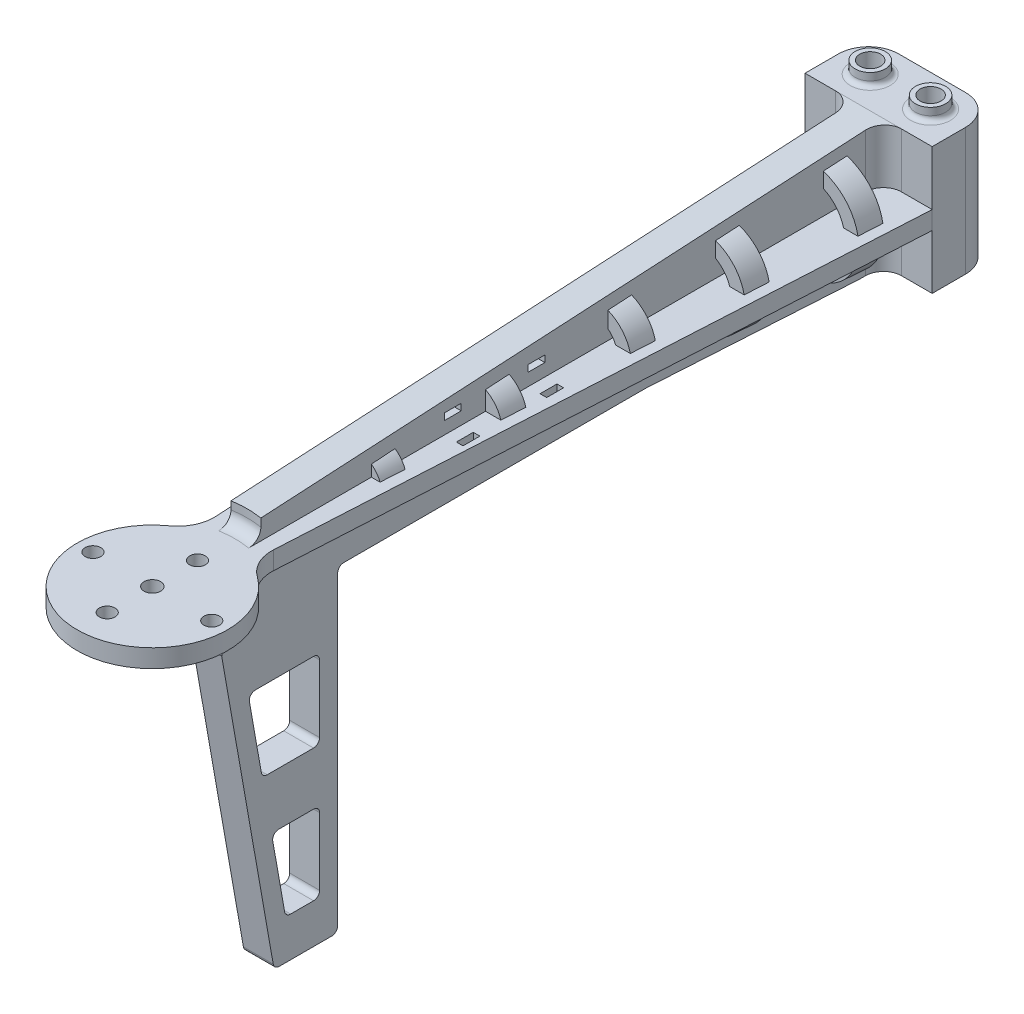
from build123d import *

# Parameters (mm, degrees)
SKETCH1_W                     = 26.7589
SKETCH1_H                     = 26.7589
BOSS_EXTRUDE1_DEPTH           = 13.37945
SKETCH2_W                     = 3.556
SKETCH2_H                     = 1.397
BOSS_EXTRUDE2_DEPTH           = 3.140604167
SKETCH3_W                     = 1.397
SKETCH3_H                     = 3.556
BOSS_EXTRUDE3_DEPTH           = 1.905
FILLET1_R                     = 6.35
SKETCH5_R                     = 15.8250001
BOSS_EXTRUDE4_DEPTH           = 1.905
SKETCH6_R                     = 13.97
CUT_EXTRUDE2_DEPTH            = 198.322668483
SKETCH25_R                    = 1.749997008
CUT_EXTRUDE8_DEPTH            = 198.322668483
SKETCH26_R                    = 1.6499967
CUT_EXTRUDE9_DEPTH            = 198.322668483
FILLET6_R                     = 7.62
BOSS_EXTRUDE6_REACH           = 197.819
SKETCH22_R                    = 6.35
SKETCH9_R                     = 3.175
BOSS_EXTRUDE5_DEPTH           = 2.54
CBORE_FOR_M3_SHCS1_AT_2_COUNT = 2
CBORE_FOR_M3_SHCS1_AT_2_PITCH = 18.9999874
FILLET9_R                     = 1
SKETCH16_R                    = 2.200000045
CUT_EXTRUDE3_DEPTH            = 204.37109041
SKETCH23_W                    = 31.6500002
SKETCH23_H                    = 25.4
CUT_EXTRUDE6_DEPTH            = 196.819485483
FILLET13_R                    = 3.81
FILLET14_R                    = 3.81
FILLET15_R                    = 3.81
FILLET16_R                    = 3.81
FILLET20_START                = 121.147482131
FILLET20_DEPTH                = 29.852517869
SKETCH28_W                    = 28.2999942
SKETCH28_H                    = 101.6
CUT_EXTRUDE11_DEPTH           = 198.322668623
SKETCH29_R                    = 19.939
CUT_EXTRUDE12_DEPTH           = 198.322668623
FILLET21_R                    = 2.54


with BuildPart() as part:
    # Sketch1 → Boss-Extrude1 (new body)
    with BuildSketch(Plane.XY):
        Rectangle(SKETCH1_W, SKETCH1_H)
    extrude(amount=BOSS_EXTRUDE1_DEPTH)

    # Sketch2 → Boss-Extrude2 (add, symmetric)
    with BuildSketch(Plane(origin=(0, 0, 0), x_dir=(0, 0, -1), z_dir=(1, 0, 0))):
        with BuildLine():
            Line((-13.37945, 13.37945), (-179.36845, 4.149725))
            Line((-179.36845, 4.149725), (-179.36845, -4.149725))
            Line((-179.36845, -4.149725), (-154.89168596, -7.372152119))
            ThreePointArc((-154.89168596, -7.372152119), (-154.179232644, -7.713884861), (-153.806748378, -8.410753907))
            Line((-153.806748378, -8.410753907), (-141.799904362, -76.504950086))
            ThreePointArc((-141.799904362, -76.504950086), (-141.36553878, -77.257293343), (-140.549198516, -77.5544169))
            Line((-140.549198516, -77.5544169), (-129.505405047, -77.5544169))
            ThreePointArc((-129.505405047, -77.5544169), (-128.607379435, -77.182442512), (-128.235405047, -76.2844169))
            Line((-128.235405047, -76.2844169), (-128.235405047, -12.0244489))
            ThreePointArc((-128.235405047, -12.0244489), (-127.86343066, -11.126423288), (-126.965405047, -10.7544489))
            Line((-126.965405047, -10.7544489), (-63.465405047, -10.7544489))
            Line((-63.465405047, -10.7544489), (-18.45945, -13.37945))
            Line((-18.45945, -13.37945), (-13.37945, -13.37945))
            Line((-13.37945, -13.37945), (-13.37945, 13.37945))
        make_face()
        with Locations((-86.410071714, 5.2348511)):
            Rectangle(SKETCH2_W, SKETCH2_H, mode=Mode.SUBTRACT)
        with Locations((-104.020738381, 5.2348511)):
            Rectangle(SKETCH2_W, SKETCH2_H, mode=Mode.SUBTRACT)
        with BuildLine():
            Line((-132.045405047, -25.9411089), (-132.045405047, -40.1011009))
            ThreePointArc((-132.045405047, -40.1011009), (-132.417379435, -40.999126512), (-133.315405047, -41.3711009))
            Line((-133.315405047, -41.3711009), (-143.060517987, -41.3711009))
            ThreePointArc((-143.060517987, -41.3711009), (-143.876858251, -41.073977343), (-144.311223833, -40.321634086))
            Line((-144.311223833, -40.321634086), (-146.808012469, -26.161642086))
            ThreePointArc((-146.808012469, -26.161642086), (-146.530183066, -25.124768636), (-145.557306623, -24.6711089))
            Line((-145.557306623, -24.6711089), (-133.315405047, -24.6711089))
            ThreePointArc((-133.315405047, -24.6711089), (-132.417379435, -25.043083288), (-132.045405047, -25.9411089))
        make_face(mode=Mode.SUBTRACT)
        with BuildLine():
            Line((-132.045405047, -53.7744289), (-132.045405047, -67.9344209))
            ThreePointArc((-132.045405047, -67.9344209), (-132.417379435, -68.832446512), (-133.315405047, -69.2044209))
            Line((-133.315405047, -69.2044209), (-138.152752708, -69.2044209))
            ThreePointArc((-138.152752708, -69.2044209), (-138.969092972, -68.907297343), (-139.403458555, -68.154954086))
            Line((-139.403458555, -68.154954086), (-141.900247191, -53.994962086))
            ThreePointArc((-141.900247191, -53.994962086), (-141.622417787, -52.958088636), (-140.649541344, -52.5044289))
            Line((-140.649541344, -52.5044289), (-133.315405047, -52.5044289))
            ThreePointArc((-133.315405047, -52.5044289), (-132.417379435, -52.876403288), (-132.045405047, -53.7744289))
        make_face(mode=Mode.SUBTRACT)
    extrude(amount=BOSS_EXTRUDE2_DEPTH, both=True)

    # Sketch3 → Boss-Extrude3 (add, symmetric)
    with BuildSketch(Plane(origin=(0, 0, 0), x_dir=(1, 0, 0), z_dir=(0, 1, 0))):
        Polygon((-13.37945, -13.37945), (13.37945, -13.37945), (4.149725, -179.36845), (-4.149725, -179.36845), align=None)
        with Locations((6.379104167, -86.410071714)):
            Rectangle(SKETCH3_W, SKETCH3_H, mode=Mode.SUBTRACT)
        with Locations((6.379104167, -104.020738381)):
            Rectangle(SKETCH3_W, SKETCH3_H, mode=Mode.SUBTRACT)
        with Locations((-6.379104167, -104.020738381)):
            Rectangle(SKETCH3_W, SKETCH3_H, mode=Mode.SUBTRACT)
        with Locations((-6.379104167, -86.410071714)):
            Rectangle(SKETCH3_W, SKETCH3_H, mode=Mode.SUBTRACT)
    extrude(amount=BOSS_EXTRUDE3_DEPTH, both=True)

    # Fillet1
    fillet1_edges = [part.edges().sort_by_distance(p)[0] for p in [
        (-13.37945, 0, 0),
        (13.37945, 0, 0),
    ]]
    fillet(fillet1_edges, radius=FILLET1_R)

    # Sketch5 → Boss-Extrude4 (add, symmetric)
    with BuildSketch(Plane(origin=(0, 0, 0), x_dir=(1, 0, 0), z_dir=(0, 1, 0))):
        with Locations((0, -164.097221805)):
            Circle(SKETCH5_R)
    extrude(amount=BOSS_EXTRUDE4_DEPTH, both=True)

    # Sketch6 → Cut-Extrude2 (cut, through all)
    with BuildSketch(Plane(origin=(0, 1.905, 0), x_dir=(1, 0, 0), z_dir=(0, 1, 0))):
        with Locations((0, -164.097221805)):
            Circle(SKETCH6_R)
    extrude(amount=CUT_EXTRUDE2_DEPTH, mode=Mode.SUBTRACT)

    # Sketch25 → Cut-Extrude8 (cut, through all)
    with BuildSketch(Plane(origin=(0, 1.905, 0), x_dir=(1, 0, 0), z_dir=(0, 1, 0))):
        with Locations(Location((0, -164.097221805, 0), (0, 0, 270))):
            Circle(SKETCH25_R)
    extrude(amount=-CUT_EXTRUDE8_DEPTH, mode=Mode.SUBTRACT)

    # Sketch26 → Cut-Extrude9 (cut, through all)
    with BuildSketch(Plane(origin=(0, 1.905, 0), x_dir=(1, 0, 0), z_dir=(0, 1, 0))):
        with Locations(Location((12.5000004, -164.097221805, 0), (0, 0, 270))):
            Circle(SKETCH26_R)
        with Locations(Location((-12.5000004, -164.097221805, 0), (0, 0, 90))):
            Circle(SKETCH26_R)
        with Locations(Location((0, -154.597228105, 0), (0, 0, 270))):
            Circle(SKETCH26_R)
        with Locations(Location((0, -173.597215505, 0), (0, 0, 270))):
            Circle(SKETCH26_R)
    extrude(amount=-CUT_EXTRUDE9_DEPTH, mode=Mode.SUBTRACT)

    # Fillet6
    fillet6_edges = [part.edges().sort_by_distance(p)[0] for p in [
        (5.817204825, 0, 149.380199138),
        (-5.817204825, 0, 149.380199138),
    ]]
    fillet(fillet6_edges, radius=FILLET6_R)

    # Boss-Extrude6: up to this plane
    boss_extrude6_end = Plane(origin=(3.140604167, -7.372152119, 154.89168596), z_dir=(0, 0.9914448613738105, -0.1305261922200519))
    # Sketch22 → Boss-Extrude6 (add, up to the surface)
    with BuildSketch(Plane.XZ.offset(1.905), mode=Mode.PRIVATE) as boss_extrude6_sk1:
        with Locations((0, 154.597228105)):
            Circle(SKETCH22_R)
    boss_extrude6_tool1 = split(extrude(boss_extrude6_sk1.sketch, amount=BOSS_EXTRUDE6_REACH, mode=Mode.PRIVATE), bisect_by=boss_extrude6_end, keep=Keep.BOTH, mode=Mode.PRIVATE)
    add(boss_extrude6_tool1.solids().sort_by_distance((0, -1.905, 154.597228))[0])

    # Sketch9 → Boss-Extrude5 (add)
    with BuildSketch(Plane(origin=(0, 13.37945, 0), x_dir=(1, 0, 0), z_dir=(0, 1, 0))):
        with Locations(Location((6.35, -6.689725, 0), (0, 0, 90))):
            Circle(SKETCH9_R)
        with Locations(Location((-6.35, -6.689725, 0), (0, 0, 90))):
            Circle(SKETCH9_R)
    boss_extrude5 = extrude(amount=BOSS_EXTRUDE5_DEPTH)

    # Mirror1: Boss-Extrude5 across plane
    add(boss_extrude5.mirror(Plane.ZX))

    # Sketch14 → CBORE for M3 SHCS1 (revolve, cut)
    with BuildSketch(Plane(origin=(0, -1.905, 173.597215505), x_dir=(0, 0, 1), z_dir=(1, 0, 0))):
        Polygon((0, 0), (0, 75.6494169), (1.7, 75.6494169), (1.7, 13), (3.75, 13), (3.75, 0), align=None)
    cbore_for_m3_shcs1 = revolve(axis=Axis((0, 4.445, 173.597215505), (0, -1, 0)), mode=Mode.SUBTRACT)

    # CBORE for M3 SHCS1 at 2: CBORE for M3 SHCS1 ×2
    with Locations(*[(0, 0, -i * CBORE_FOR_M3_SHCS1_AT_2_PITCH) for i in range(1, CBORE_FOR_M3_SHCS1_AT_2_COUNT)]):
        add(cbore_for_m3_shcs1, mode=Mode.SUBTRACT)

    # Fillet9
    fillet9_edges = [part.edges().sort_by_distance(p)[0] for p in [
        (6.35, 13.37945, 9.864725),
        (-6.35, 13.37945, 9.864725),
        (6.35, -13.37945, 9.864725),
        (-6.35, -13.37945, 9.864725),
    ]]
    fillet(fillet9_edges, radius=FILLET9_R)

    # Sweep1: sweep along a path in Sketch19
    with BuildLine(Plane.XY.offset(55.329666667)) as sweep1_path:
        CenterArc((0, 0), 20.682824309, 0, 360)
    # Sketch20 → Sweep1 (sweep)
    with BuildSketch(Plane(origin=(0, 0, 0), x_dir=(1, 0, 0), z_dir=(0, 1, 0))):
        Polygon((-6.384341414, -43.734896714), (-9.619049679, -43.734896714), (-9.342449227, -48.709327964), (-6.384341414, -48.709327964), align=None)
        Polygon((-8.359098648, -66.394077964), (-5.124390383, -66.394077964), (-5.124390383, -71.368509214), (-8.082498196, -71.368509214), align=None)
        Polygon((-10.87900071, -21.075715464), (-7.644292445, -21.075715464), (-7.644292445, -26.050146714), (-10.602400258, -26.050146714), align=None)
        Polygon((-5.591166853, -116.173050881), (-2.356458588, -116.173050881), (-2.356458588, -121.147482131), (-5.3145664, -121.147482131), align=None)
        Polygon((-6.92657577, -92.156821714), (-3.691867505, -92.156821714), (-3.691867505, -97.131252964), (-6.649975318, -97.131252964), align=None)
    sweep(path=sweep1_path.line)

    # Sketch16 → Cut-Extrude3 (cut, through all)
    with BuildSketch(Plane(origin=(0, 15.91945, 0), x_dir=(1, 0, 0), z_dir=(0, 1, 0))):
        with Locations(Location((6.35, -6.689725, 0), (0, 0, 270))):
            Circle(SKETCH16_R)
        with Locations(Location((-6.35, -6.689725, 0), (0, 0, 270))):
            Circle(SKETCH16_R)
    extrude(amount=-CUT_EXTRUDE3_DEPTH, mode=Mode.SUBTRACT)

    # Sketch23 → Cut-Extrude6 (cut, through all)
    with BuildSketch(Plane.XZ.offset(1.905)):
        with Locations((0, 176.797221805)):
            Rectangle(SKETCH23_W, SKETCH23_H)
    extrude(amount=CUT_EXTRUDE6_DEPTH, mode=Mode.SUBTRACT)

    # Fillet13
    fillet13_edges = [part.edges().sort_by_distance(p)[0] for p in [
        (-3.140604167, -7.642225, 13.37945),
    ]]
    fillet(fillet13_edges, radius=FILLET13_R)

    # Fillet14
    # the kernel refuses this fillet: 3.81 mm, written as the material it adds along each edge
    with BuildSketch(Plane(origin=(-3.140604167, -7.62, 13.37945), x_dir=(-1, 0, 0), z_dir=(0, 1, 0))) as fillet14_piece_1_section:
        with BuildLine():
            CenterArc((FILLET14_R, FILLET14_R), FILLET14_R, 180, 90)
            Line((0, FILLET14_R), (0, 0))
            Line((0, 0), (FILLET14_R, 0))
        make_face()
    fillet14_piece_1 = extrude(amount=20.99945, mode=Mode.PRIVATE)
    fillet14_piece_1 = split(fillet14_piece_1, bisect_by=Plane(origin=(-3.140604167, 13.314722904, 14.543513494), z_dir=(0, -0.9984576488798522, -0.05551867607677383)), keep=Keep.TOP, mode=Mode.PRIVATE)
    add(fillet14_piece_1)

    # Fillet15
    # the kernel refuses this fillet: 3.81 mm, written as the material it adds along each edge
    with BuildSketch(Plane(origin=(3.140604167, 1.905, 13.37945), x_dir=(0, 0, 1), z_dir=(0, 1, 0))) as fillet15_piece_1_section:
        with BuildLine():
            CenterArc((FILLET15_R, FILLET15_R), FILLET15_R, 180, 90)
            Line((0, FILLET15_R), (0, 0))
            Line((0, 0), (FILLET15_R, 0))
        make_face()
    fillet15_piece_1 = extrude(amount=20.99945, mode=Mode.PRIVATE)
    fillet15_piece_1 = split(fillet15_piece_1, bisect_by=Plane(origin=(3.140604167, 13.344082034, 14.015513724), z_dir=(0, -0.9984576488798522, -0.05551867607677383)), keep=Keep.TOP, mode=Mode.PRIVATE)
    add(fillet15_piece_1)

    # Fillet16
    fillet16_edges = [part.edges().sort_by_distance(p)[0] for p in [
        (3.140604167, -7.642225, 13.37945),
    ]]
    fillet(fillet16_edges, radius=FILLET16_R)

    # Fillet20: read off the stored shape, not the designer's step
    # Fillet20 outline → Fillet20 (add)
    with BuildSketch(Plane.XY.offset(FILLET20_START)):
        with BuildLine():
            add(Edge.make_bspline(
                [(3.902604167, -1.905), (3.140604167, -1.905), (3.140604167, -2.667)],
                knots=[0, 0, 0, 1, 1, 1], degree=2, weights=[1, 0.707106781, 1]))
            Line((3.902604167, -1.905), (3.140604167, -1.905))
            Line((3.140604167, -1.905), (3.140604167, -2.667))
        make_face()
    extrude(amount=FILLET20_DEPTH)

    # Sketch28 → Cut-Extrude11 (cut, through all)
    with BuildSketch(Plane(origin=(0, 1.905, 0), x_dir=(1, 0, 0), z_dir=(0, 1, 0))):
        with Locations((0, -216.647218813)):
            Rectangle(SKETCH28_W, SKETCH28_H)
    extrude(amount=CUT_EXTRUDE11_DEPTH, mode=Mode.SUBTRACT)

    # Sketch29 → Cut-Extrude12 (cut, through all)
    with BuildSketch(Plane(origin=(0, 1.905, 0), x_dir=(1, 0, 0), z_dir=(0, 1, 0))):
        with Locations((0, -164.097221805)):
            Circle(SKETCH29_R)
    extrude(amount=CUT_EXTRUDE12_DEPTH, mode=Mode.SUBTRACT)

    # Fillet21
    # the kernel refuses this fillet: 2.54 mm, written as the material it adds along each edge
    with BuildSketch(Plane(origin=(0, 1.905, 164.097221805), x_dir=(0.4588014399086393, 0, -0.8885388223019629), z_dir=(0.8885388223019629, 0, 0.4588014399086393))) as fillet21_piece_1_section:
        with BuildLine():
            CenterArc((19.939 - FILLET21_R, FILLET21_R), FILLET21_R, 270, 90)
            Line((19.939, FILLET21_R), (19.939, 0))
            Line((19.939, 0), (19.939 - FILLET21_R, 0))
        make_face()
    fillet21_piece_1 = revolve(axis=Axis((0, 1.905, 164.097221805), (0, 1, 0)), revolution_arc=54.619587236, mode=Mode.PRIVATE)
    fillet21_piece_1 = split(fillet21_piece_1, bisect_by=Plane(origin=(-3.140604167, 1.905, 164.097221805), z_dir=(1, 0, 0)), keep=Keep.TOP, mode=Mode.PRIVATE)
    fillet21_piece_1 = split(fillet21_piece_1, bisect_by=Plane(origin=(3.140604167, 1.905, 164.097221805), z_dir=(-1, 0, 0)), keep=Keep.TOP, mode=Mode.PRIVATE)
    add(fillet21_piece_1)


solid = part.part
